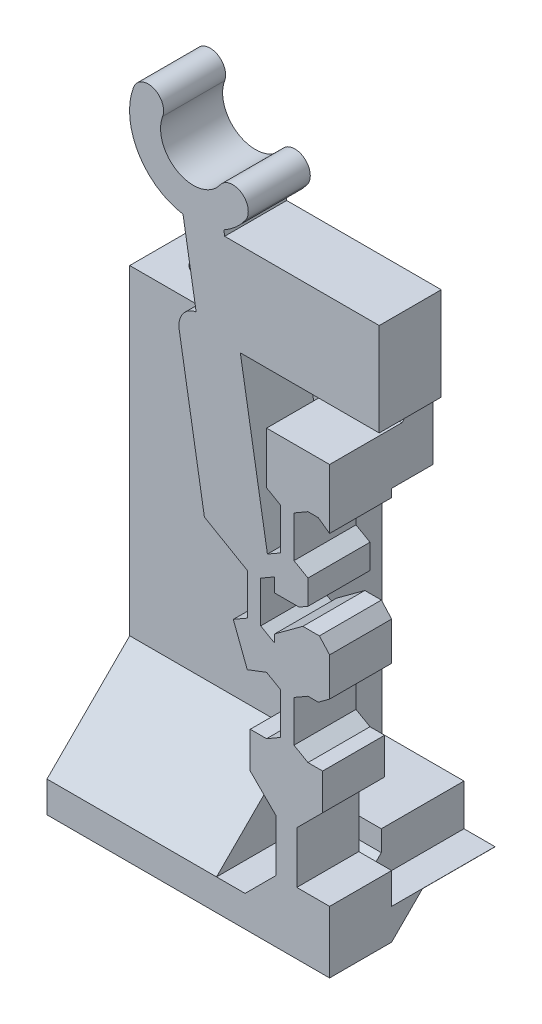
from build123d import *

# Parameters (mm, degrees)
BOSS_SWITCH_BODY_DEPTH                    = 3
SKETCH1_W                                 = 4.0875
SKETCH1_H                                 = 1.5
SKETCH1_W_2                               = 3.046903414
SKETCH1_H_2                               = 3.5
BOSS_FLANGE_WIDTH_DEPTH                   = 5
SKETCH2_W                                 = 4
SKETCH2_H                                 = 2
SKETCH2_W_2                               = 8
SKETCH2_H_2                               = 1.5
BOSS_FLANGE_HEIGHT_DEPTH                  = 10.620596586
CUT_UP_TO_DOWN_DERAILLEUR_CLEARANCE_REACH = 23.629
SKETCH10_W                                = 1.5
SKETCH10_H                                = 3
SKETCH17_W                                = 12.1675
SKETCH17_H                                = 4
BOSS_FLANGE_SUPPORT_DEPTH                 = 17.508325141
TAP_DRILL_FOR_M2X0_4_TAP1_D               = 1.6
M2_CLEARANCE_HOLE2_D                      = 2.4
M2_CLEARANCE_HOLE2_DEPTH                  = 15
M2_CLEARANCE_HOLE2_TIP                    = 0.721032743
CHAMFER_FLANGE_SUPPORT_SIZE               = 1.5
CHAMFER_FLANGE_SUPPORT_2_SIZE             = 1.5
SKETCH23_W                                = 7.349718646
SKETCH23_H                                = 15.508325141
CUT_GAP_FOR_PRINTING_DEPTH                = 32.000499688
CUT_WIDE_DERAILLEUR_CLEARANCE_DEPTH       = 33.195879702
CUT_WIDE_DERAILLEUR_CLEARANCE_DEPTH_BACK  = 4
SKETCH27_W                                = 2.5
SKETCH27_H                                = 3.5
CHAMFER9_SIZE                             = 1.25
SKETCH28_W                                = 3.046903414
SKETCH28_H                                = 1
CUT_EXTRUDE1_DEPTH                        = 1
CHAMFER10_SIZE                            = 0.5
CHAMFER_FLANGE_SUPPORT_3_SIZE             = 1
CUT_EXTRUDE2_DEPTH                        = 34.862828732
BOSS_EXTRUDE2_DEPTH                       = 8.2


with BuildPart() as part:
    # Sketch-SwitchBossUp → Boss-Switch Body (new body)
    with BuildSketch(Plane.XY):
        with BuildLine():
            Line((5.581091204, 12.554885442), (5.58109997, 11.370542897))
            Line((5.58109997, 11.370542897), (5.154266051, 11.12411022))
            Line((5.154266051, 11.12411022), (3.971266051, 11.12411022))
            Line((3.971266051, 11.12411022), (3.97126394, 11.79911022))
            Line((3.97126394, 11.79911022), (3.296271341, 11.409403061))
            Line((3.296271341, 11.409403061), (3.296271341, 9.409403061))
            Line((3.296271341, 9.409403061), (3.971278743, 9.019687356))
            Line((3.971278743, 9.019687356), (3.971278743, 9.409408058))
            Line((3.971278743, 9.409408058), (5.333511297, 10.40941814))
            Line((5.333511297, 10.40941814), (6.133511297, 10.409424062))
            Line((6.133511297, 10.409424062), (6.627976927, 9.860264345))
            Line((6.627976927, 9.860264345), (6.627976927, 8.007577878))
            Line((6.627976927, 8.007577878), (6.081127833, 7.606137899))
            Line((6.081127833, 7.606137899), (5.581127833, 7.606137899))
            Line((5.581127833, 7.606137899), (4.906138119, 7.216432406))
            Line((4.906138119, 7.216432406), (4.906138119, 5.216432406))
            Line((4.906138119, 5.216432406), (5.58114552, 4.826716701))
            Line((5.58114552, 4.826716701), (6.290476927, 4.826716701))
            Line((6.290476927, 4.826716701), (6.290476927, 3.076720436))
            Line((6.290476927, 3.076720436), (5.040476927, 1.826720436))
            Line((5.040476927, 1.826720436), (5.040476927, -0.673279564))
            Line((5.040476927, -0.673279564), (6.627976927, -0.673279564))
            Line((6.627976927, -0.673279564), (6.627976927, -3.673279564))
            Line((6.627976927, -3.673279564), (2.540476927, -3.673279564))
            Line((2.540476927, -3.673279564), (2.540476927, -2.173279564))
            Line((2.540476927, -2.173279564), (4.040476927, -0.673279564))
            Line((4.040476927, -0.673279564), (4.040476927, 1.826720436))
            Line((4.040476927, 1.826720436), (2.790476927, 3.076720436))
            Line((2.790476927, 3.076720436), (2.790476927, 4.826720436))
            Line((2.790476927, 4.826720436), (3.58114552, 4.826720436))
            Line((3.58114552, 4.826720436), (4.256138119, 5.216427595))
            Line((4.256138119, 5.216427595), (4.256138119, 7.216427595))
            Line((4.256138119, 7.216427595), (3.581130717, 7.6061433))
            Line((3.581130717, 7.6061433), (2.64686251, 7.249572244))
            Line((2.64686251, 7.249572244), (1.971281627, 9.019692757))
            Line((1.971281627, 9.019692757), (2.646271341, 9.40939825))
            Line((2.646271341, 9.40939825), (2.646271341, 11.40939825))
            Line((2.646271341, 11.40939825), (1.696557212, 11.957715958))
            Line((1.696557212, 11.957715958), (0.573317845, 12.60621851))
            Line((0.573317845, 12.60621851), (-0.645153605, 19.844362607))
            ThreePointArc((-0.645153605, 19.844362607), (-0.473707256, 20.590279886), (0.174966786, 20.996492176))
            Line((0.174966786, 20.996492176), (-0.46073685, 24.772792819))
            ThreePointArc((-0.46073685, 24.772792819), (-1.019582136, 24.919522879), (-1.541303694, 25.167805745))
            ThreePointArc((-1.541303694, 25.167805745), (-2.872284003, 26.795385437), (-2.852546321, 28.897797067))
            ThreePointArc((-2.852546321, 28.897797067), (-1.887813913, 29.338582026), (-1.447028953, 28.373849618))
            ThreePointArc((-1.447028953, 28.373849618), (-0.703448682, 26.416936722), (1.333779254, 26.898727173))
            ThreePointArc((1.333779254, 26.898727173), (2.379722745, 27.074801628), (2.555797201, 26.028858137))
            ThreePointArc((2.555797201, 26.028858137), (2.086504637, 25.507104397), (1.511513111, 25.104801997))
            Line((1.511513111, 25.104801997), (1.553598189, 24.854801997))
            Line((1.553598189, 24.854801997), (9.027976927, 24.854801997))
            Line((9.027976927, 24.854801997), (9.027976927, 22.354801997))
            Line((9.027976927, 22.354801997), (9.027976927, 20.354801997))
            Line((9.027976927, 20.354801997), (2.311129602, 20.354801997))
            Line((2.311129602, 20.354801997), (3.620242387, 12.578216848))
            Line((3.620242387, 12.578216848), (4.255457038, 12.944958198))
            Line((4.255457038, 12.944958198), (4.255457038, 14.944958198))
            Line((4.255457038, 14.944958198), (3.579805878, 15.335045577))
            Line((3.579805878, 15.335045577), (3.581073513, 15.335045577))
            Line((3.581073513, 15.335045577), (3.581073513, 17.835045577))
            Line((3.581073513, 17.835045577), (5.725580434, 17.835045577))
            Line((5.725580434, 17.835045577), (6.627976927, 17.835045577))
            Line((6.627976927, 17.835045577), (6.627976927, 14.94496801))
            Line((6.627976927, 14.94496801), (6.081099865, 15.335045577))
            Line((6.081099865, 15.335045577), (5.581099865, 15.335045577))
            Line((5.581099865, 15.335045577), (4.905457038, 14.944963009))
            Line((4.905457038, 14.944963009), (4.905457038, 12.944963009))
            Line((4.905457038, 12.944963009), (5.581091204, 12.554885442))
        make_face()
    extrude(amount=BOSS_SWITCH_BODY_DEPTH)

    # Sketch1 → Boss-Flange Width (add)
    with BuildSketch(Plane(origin=(0, 0, 0), x_dir=(-1, 0, 0), z_dir=(0, 0, -1))):
        with Locations((-4.584226927, -2.923279564)):
            Rectangle(SKETCH1_W, SKETCH1_H)
        with Locations((-5.10452522, 17.085045577)):
            Rectangle(SKETCH1_W_2, SKETCH1_H_2)
    extrude(amount=BOSS_FLANGE_WIDTH_DEPTH)

    # Sketch2 → Boss-Flange Height (add)
    with BuildSketch(Plane(origin=(-7.039523073, 0, 0), x_dir=(0, 0, -1), z_dir=(1, 0, 0))):
        with Locations((3, 16.335045577)):
            Rectangle(SKETCH2_W, SKETCH2_H)
        with Locations((1, -2.923279564)):
            Rectangle(SKETCH2_W_2, SKETCH2_H_2)
    extrude(amount=BOSS_FLANGE_HEIGHT_DEPTH)

    # Sketch10 → Cut-Up-To-Down Derailleur Clearance (cut, up to next)
    with BuildSketch(Plane(origin=(0, 15.335045577, 0), x_dir=(1, 0, 0), z_dir=(0, 1, 0)), mode=Mode.PRIVATE) as cut_up_to_down_derailleur_clearance_sk1:
        with Locations((5.877976927, 3.5)):
            Rectangle(SKETCH10_W, SKETCH10_H)
    cut_up_to_down_derailleur_clearance_tool1 = extrude(cut_up_to_down_derailleur_clearance_sk1.sketch, amount=CUT_UP_TO_DOWN_DERAILLEUR_CLEARANCE_REACH, mode=Mode.PRIVATE) & part.part
    add(cut_up_to_down_derailleur_clearance_tool1.solids().sort_by_distance((5.877977, 15.335046, -3.5))[0], mode=Mode.SUBTRACT)

    # Sketch17 → Boss-Flange Support (add)
    with BuildSketch(Plane.XZ.offset(-15.335045577)):
        with Locations((-0.955773073, -3)):
            Rectangle(SKETCH17_W, SKETCH17_H)
    extrude(amount=BOSS_FLANGE_SUPPORT_DEPTH)

    # Tap Drill for M2x0.4 Tap1 (through all)
    with Locations(Plane(origin=(0, -3.673279564, 0), x_dir=(-1, 0, 0), z_dir=(0, -1, 0))):
        with Locations((5.039523073, 3), (0.539523073, 3)):
            Hole(TAP_DRILL_FOR_M2X0_4_TAP1_D / 2)

    # M2 Clearance Hole2
    with Locations(Plane.XZ.offset(3.673279564)):
        with Locations((-5.039523073, -3), (-0.539523073, -3)):
            Hole(M2_CLEARANCE_HOLE2_D / 2, depth=M2_CLEARANCE_HOLE2_DEPTH)
            with Locations((0, 0, -(M2_CLEARANCE_HOLE2_DEPTH + M2_CLEARANCE_HOLE2_TIP / 2))):  # 118° drill point
                Cone(0, M2_CLEARANCE_HOLE2_D / 2, M2_CLEARANCE_HOLE2_TIP, mode=Mode.SUBTRACT)

    # Chamfer-Flange Support
    chamfer_flange_support_edges = [part.edges().sort_by_distance(p)[0] for p in [
        (3.581073513, 17.335045577, -3),
    ]]
    chamfer(chamfer_flange_support_edges, length=CHAMFER_FLANGE_SUPPORT_SIZE - 0.0001)  # a hair under: the kernel refuses the full size

    # Chamfer-Flange Support 2
    chamfer_flange_support_2_edges = [part.edges().sort_by_distance(p)[0] for p in [
        (5.127976927, 17.085045577, -2),
        (5.127976927, 15.335045577, -1.5),
    ]]
    chamfer(chamfer_flange_support_2_edges, length=CHAMFER_FLANGE_SUPPORT_2_SIZE - 0.0001)  # a hair under: the kernel refuses the full size

    # Sketch23 → Cut-Gap for Printing (cut, through all)
    with BuildSketch(Plane.XY.offset(-1)):
        with Locations((4.83533625, 7.580883007)):
            Rectangle(SKETCH23_W, SKETCH23_H)
    extrude(amount=-CUT_GAP_FOR_PRINTING_DEPTH, mode=Mode.SUBTRACT)

    # Sketch27 → Cut-Wide Derailleur Clearance (cut, two sides: drawn at the far end of the back side and taken through both)
    with BuildSketch(Plane(origin=(5.127976927, 0, 0), x_dir=(0, 0, -1), z_dir=(1, 0, 0)).offset(-CUT_WIDE_DERAILLEUR_CLEARANCE_DEPTH_BACK)):
        with Locations((3.75, 17.085045577)):
            Rectangle(SKETCH27_W, SKETCH27_H)
    extrude(amount=CUT_WIDE_DERAILLEUR_CLEARANCE_DEPTH + CUT_WIDE_DERAILLEUR_CLEARANCE_DEPTH_BACK, mode=Mode.SUBTRACT)

    # Chamfer9
    chamfer9_edges = [part.edges().sort_by_distance(p)[0] for p in [
        (4.85447522, 18.835045577, -2.5),
    ]]
    chamfer(chamfer9_edges, length=CHAMFER9_SIZE)

    # Sketch28 → Cut-Extrude1 (cut)
    with BuildSketch(Plane.XY.offset(-1)):
        with Locations((5.10452522, 18.335045577)):
            Rectangle(SKETCH28_W, SKETCH28_H)
    extrude(amount=CUT_EXTRUDE1_DEPTH, mode=Mode.SUBTRACT)

    # Chamfer10
    chamfer10_edges = [part.edges().sort_by_distance(p)[0] for p in [
        (3.581073513, 16.335045577, -1),
        (5.10452522, 17.835045577, -1),
    ]]
    chamfer(chamfer10_edges, length=CHAMFER10_SIZE - 0.0001)  # a hair under: the kernel refuses the full size

    # Chamfer-Flange Support 3
    chamfer_flange_support_3_edges = [part.edges().sort_by_distance(p)[0] for p in [
        (-0.955773073, -2.173279564, -1),
    ]]
    chamfer(chamfer_flange_support_3_edges, length=CHAMFER_FLANGE_SUPPORT_3_SIZE - 0.0001)  # a hair under: the kernel refuses the full size

    # Sketch31 → Cut-Extrude2 (cut, through all)
    with BuildSketch(Plane.ZY.offset(7.039523073)):
        Polygon((-5, -2.180661432), (-5, -3.673279564), (0, -3.673279564), (-1.492618132, -2.180661432), align=None)
    extrude(amount=-CUT_EXTRUDE2_DEPTH, mode=Mode.SUBTRACT)

    # Sketch32 → Boss-Extrude2 (add)
    with BuildSketch(Plane.ZY.offset(7.039523073)):
        Polygon((3, -2.173279564), (-1, 1.826720436), (-1, -2.082793031), (0.406297605, -3.355496176), (3, -3.355496176), align=None)
    extrude(amount=-BOSS_EXTRUDE2_DEPTH)


solid = part.part
